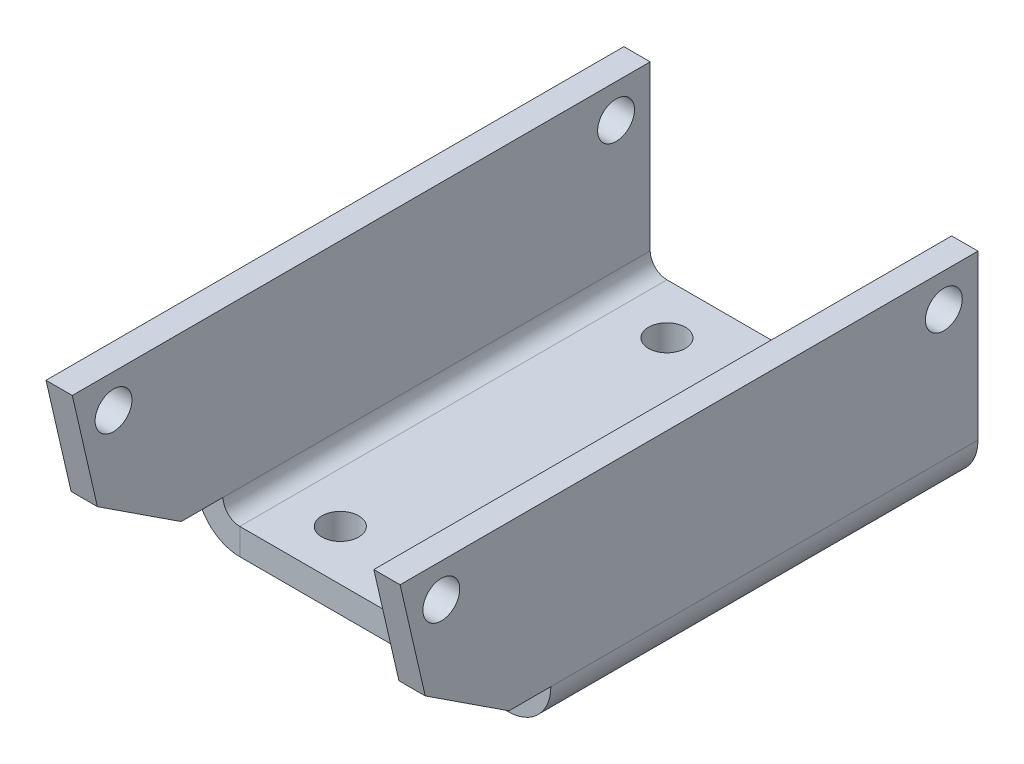
from build123d import *

# Parameters (mm, degrees)
SKETCH1_W           = 16
SKETCH1_H           = 25.5
SKETCH1_R           = 1.1
BASE_FLANGE1_DEPTH  = 1.57
EDGE_FLANGE2_DEPTH  = 25.5
EDGE_FLANGE3_DEPTH  = 25.5
SKETCH23_W          = 1.57
SKETCH23_H          = 9.77
BOSS_EXTRUDE1_DEPTH = 9
CUT_EXTRUDE1_DEPTH  = 33.18625483
SKETCH29_R          = 1.1
CUT_EXTRUDE2_DEPTH  = 33.18625483


# Sheet-metal steps are written as plain solids
with BuildPart() as part:
    # Sketch1 → Base-Flange1 (new body)
    with BuildSketch(Plane(origin=(0, 0, 0), x_dir=(1, 0, 0), z_dir=(0, 1, 0))):
        Rectangle(SKETCH1_W, SKETCH1_H)
        with Locations(Location((-5, 9.75, 0), (0, 0, 270))):
            Circle(SKETCH1_R, mode=Mode.SUBTRACT)
        with Locations(Location((5, 9.75, 0), (0, 0, 270))):
            Circle(SKETCH1_R, mode=Mode.SUBTRACT)
        with Locations(Location((-5, -9.75, 0), (0, 0, 270))):
            Circle(SKETCH1_R, mode=Mode.SUBTRACT)
        with Locations(Location((5, -9.75, 0), (0, 0, 270))):
            Circle(SKETCH1_R, mode=Mode.SUBTRACT)
    extrude(amount=-BASE_FLANGE1_DEPTH)

    # Edge-Flange2 section (across the edge) → Edge-Flange2 (add)
    with BuildSketch(Plane(origin=(9, 0, 12.75), x_dir=(-1, 0, 0), z_dir=(0, 0, -1))):
        with BuildLine():
            Line((-1.57, 1), (-1.57, 10.77))
            Line((-1.57, 10.77), (0, 10.77))
            Line((0, 10.77), (0, 1))
            ThreePointArc((0, 1), (0.292893219, 0.292893219), (1, 0))
            Line((1, 0), (1, -1.57))
            ThreePointArc((1, -1.57), (-0.817264428, -0.817264428), (-1.57, 1))
        make_face()
    extrude(amount=EDGE_FLANGE2_DEPTH)

    # Edge-Flange3 section (across the edge) → Edge-Flange3 (add)
    with BuildSketch(Plane(origin=(-9, 0, -12.75), x_dir=(1, 0, 0), z_dir=(0, 0, 1))):
        with BuildLine():
            Line((-1.57, 1), (-1.57, 10.77))
            Line((-1.57, 10.77), (0, 10.77))
            Line((0, 10.77), (0, 1))
            ThreePointArc((0, 1), (0.292893219, 0.292893219), (1, 0))
            Line((1, 0), (1, -1.57))
            ThreePointArc((1, -1.57), (-0.817264428, -0.817264428), (-1.57, 1))
        make_face()
    extrude(amount=EDGE_FLANGE3_DEPTH)

    # Sketch23 → Boss-Extrude1 (add)
    with BuildSketch(Plane.XY.offset(12.75)):
        with Locations((-9.785, 5.885)):
            Rectangle(SKETCH23_W, SKETCH23_H)
        with Locations((9.785, 5.885)):
            Rectangle(SKETCH23_W, SKETCH23_H)
    extrude(amount=BOSS_EXTRUDE1_DEPTH)

    # Sketch24 → Cut-Extrude1 (cut, through all)
    with BuildSketch(Plane(origin=(10.57, 0, 0), x_dir=(0, 0, -1), z_dir=(1, 0, 0))):
        Polygon((-21.75, 10.77), (-21.75, 1), (-15.25, 1), (-20.25, 4.27), align=None)
    extrude(amount=-CUT_EXTRUDE1_DEPTH, mode=Mode.SUBTRACT)

    # Sketch29 → Cut-Extrude2 (cut, through all)
    with BuildSketch(Plane(origin=(10.57, 0, 0), x_dir=(0, 0, -1), z_dir=(1, 0, 0))):
        with Locations(Location((-19.288461538, 8.77, 0), (0, 0, 90))):
            Circle(SKETCH29_R)
        with Locations(Location((10.711538462, 8.77, 0), (0, 0, 90))):
            Circle(SKETCH29_R)
    extrude(amount=-CUT_EXTRUDE2_DEPTH, mode=Mode.SUBTRACT)


solid = part.part
